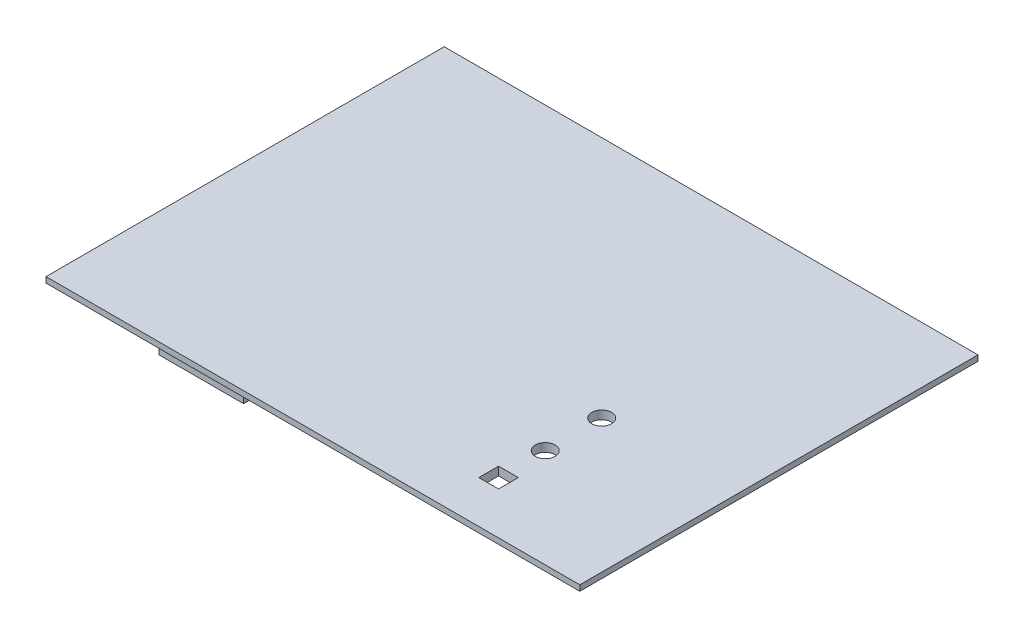
from build123d import *

# Parameters (mm, degrees)
ESBO_O1_W                = 179
ESBO_O1_H                = 131
RESSALTO_EXTRUS_O1_DEPTH = 1
ESBO_O2_W                = 189
ESBO_O2_H                = 141
RESSALTO_EXTRUS_O2_DEPTH = 2
ESBO_O3_R                = 3.5
ESBO_O3_W                = 7
ESBO_O3_H                = 7
CORTE_EXTRUS_O1_DEPTH    = 118.938543318
ESBO_O4_W                = 30
ESBO_O4_H                = 2
RESSALTO_EXTRUS_O3_DEPTH = 12
ESBO_O5_W                = 30
ESBO_O5_H                = 6
RESSALTO_EXTRUS_O4_DEPTH = 2


with BuildPart() as part:
    # Esboço1 → Ressalto-extrusão1 (new body)
    with BuildSketch(Plane(origin=(0, 0, 0), x_dir=(1, 0, 0), z_dir=(0, 1, 0))):
        Rectangle(ESBO_O1_W, ESBO_O1_H)
    extrude(amount=RESSALTO_EXTRUS_O1_DEPTH)

    # Esboço2 → Ressalto-extrusão2 (add)
    with BuildSketch(Plane(origin=(0, 1, 0), x_dir=(1, 0, 0), z_dir=(0, 1, 0))):
        Rectangle(ESBO_O2_W, ESBO_O2_H)
    extrude(amount=RESSALTO_EXTRUS_O2_DEPTH)

    # Esboço3 → Corte-extrusão1 (cut, through all)
    with BuildSketch(Plane(origin=(0, 3, 0), x_dir=(1, 0, 0), z_dir=(0, 1, 0))):
        with Locations((47.25, -35.5)):
            Circle(ESBO_O3_R)
        with Locations((47.25, -15.5)):
            Circle(ESBO_O3_R)
        with Locations((47.25, -52)):
            Rectangle(ESBO_O3_W, ESBO_O3_H)
    extrude(amount=-CORTE_EXTRUS_O1_DEPTH, mode=Mode.SUBTRACT)

    # Esboço4 → Ressalto-extrusão3 (add)
    with BuildSketch(Plane(origin=(0, 3, 0), x_dir=(1, 0, 0), z_dir=(0, 1, 0))):
        with Locations((-49.555558526, -59.5)):
            Rectangle(ESBO_O4_W, ESBO_O4_H)
        with Locations((-49.555558526, -16.5)):
            Rectangle(ESBO_O4_W, ESBO_O4_H)
    extrude(amount=-RESSALTO_EXTRUS_O3_DEPTH)

    # Esboço5 → Ressalto-extrusão4 (add)
    with BuildSketch(Plane.XZ.offset(9)):
        with Locations((-49.555558526, 57.5)):
            Rectangle(ESBO_O5_W, ESBO_O5_H)
        with Locations((-49.555558526, 18.5)):
            Rectangle(ESBO_O5_W, ESBO_O5_H)
    extrude(amount=RESSALTO_EXTRUS_O4_DEPTH)


solid = part.part
